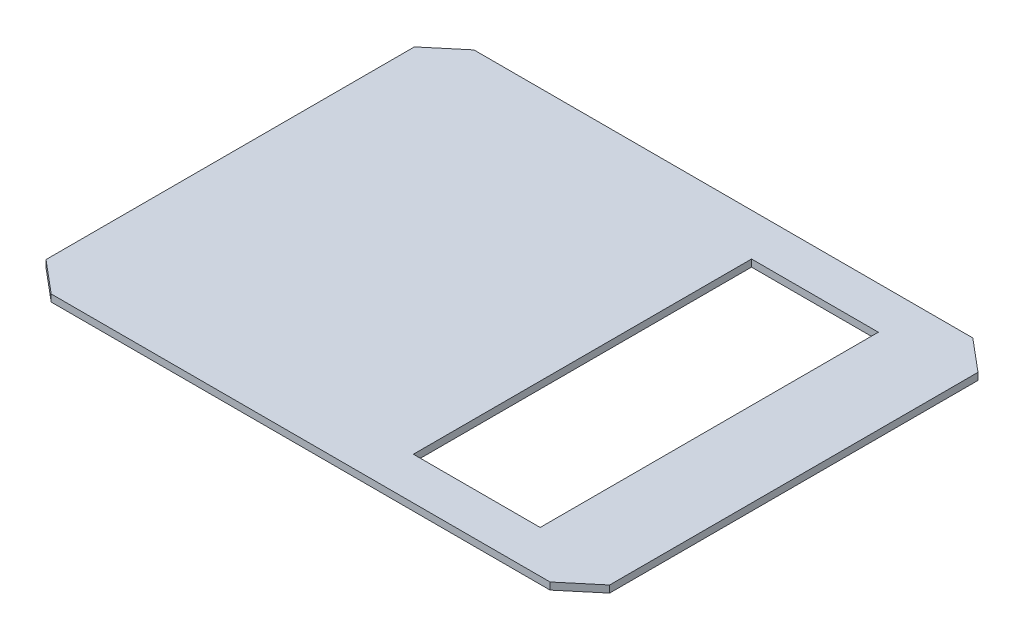
from build123d import *

# Parameters (mm, degrees)
BOSS_EXTRUDE1_DEPTH = 3.175
SKETCH2_W           = 57.15
SKETCH2_H           = 152.4
CUT_EXTRUDE1_DEPTH  = 159.781746826


with BuildPart() as part:
    # Sketch1 → Boss-Extrude1 (new body)
    with BuildSketch(Plane(origin=(0, 0, 0), x_dir=(1, 0, 0), z_dir=(0, 1, 0))):
        Polygon((112.406853359, -95.25), (127, -83.004896035), (127, 83.004896035), (112.406853359, 95.25), (-112.406853359, 95.25), (-127, 83.004896035), (-127, -83.004896035), (-112.406853359, -95.25), align=None)
    extrude(amount=BOSS_EXTRUDE1_DEPTH)

    # Sketch2 → Cut-Extrude1 (cut, through all)
    with BuildSketch(Plane(origin=(0, 3.175, 0), x_dir=(1, 0, 0), z_dir=(0, 1, 0))):
        with Locations((60.325, 0)):
            Rectangle(SKETCH2_W, SKETCH2_H)
    extrude(amount=-CUT_EXTRUDE1_DEPTH, mode=Mode.SUBTRACT)


solid = part.part
